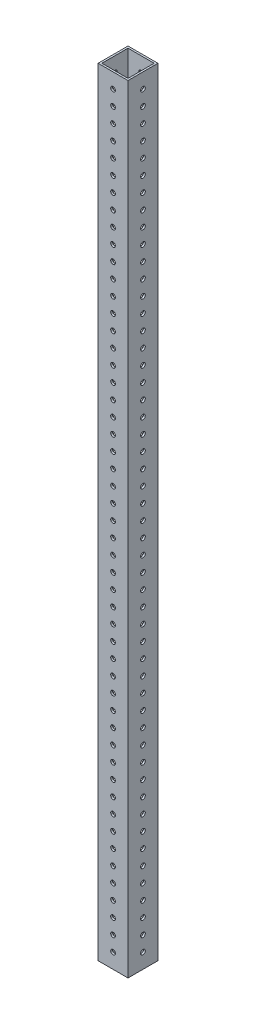
from build123d import *

# Parameters (mm, degrees)
SKETCH1_W                   = 25.4
SKETCH1_H                   = 25.4
SKETCH1_W_2                 = 22.225
SKETCH1_H_2                 = 22.225
BOSS_EXTRUDE1_DEPTH         = 660.4
F_22_0_157_DIAMETER_HOLE1_D = 3.9878
LPATTERN1_COUNT             = 51
LPATTERN1_PITCH             = 12.7
F_22_0_157_DIAMETER_HOLE2_D = 3.9878
LPATTERN2_COUNT             = 51
LPATTERN2_PITCH             = 12.7


with BuildPart() as part:
    # Sketch1 → Boss-Extrude1 (new body)
    with BuildSketch(Plane(origin=(0, 0, 0), x_dir=(1, 0, 0), z_dir=(0, 1, 0))):
        Rectangle(SKETCH1_W, SKETCH1_H)
        Rectangle(SKETCH1_W_2, SKETCH1_H_2, mode=Mode.SUBTRACT)
    extrude(amount=BOSS_EXTRUDE1_DEPTH)

    # #22 (0.157) Diameter Hole1 (through all)
    with Locations(Plane.XY.offset(12.7)):
        with Locations((0, 12.7)):
            f_22_0_157_diameter_hole1 = Hole(F_22_0_157_DIAMETER_HOLE1_D / 2)

    # LPattern1: #22 (0.157) Diameter Hole1 ×51
    with Locations(*[(0, i * LPATTERN1_PITCH, 0) for i in range(1, LPATTERN1_COUNT)]):
        add(f_22_0_157_diameter_hole1, mode=Mode.SUBTRACT)

    # #22 (0.157) Diameter Hole2 (through all)
    with Locations(Plane(origin=(12.7, 0, 0), x_dir=(0, 0, -1), z_dir=(1, 0, 0))):
        with Locations((0, 12.7)):
            f_22_0_157_diameter_hole2 = Hole(F_22_0_157_DIAMETER_HOLE2_D / 2)

    # LPattern2: #22 (0.157) Diameter Hole2 ×51
    with Locations(*[(0, i * LPATTERN2_PITCH, 0) for i in range(1, LPATTERN2_COUNT)]):
        add(f_22_0_157_diameter_hole2, mode=Mode.SUBTRACT)


solid = part.part
